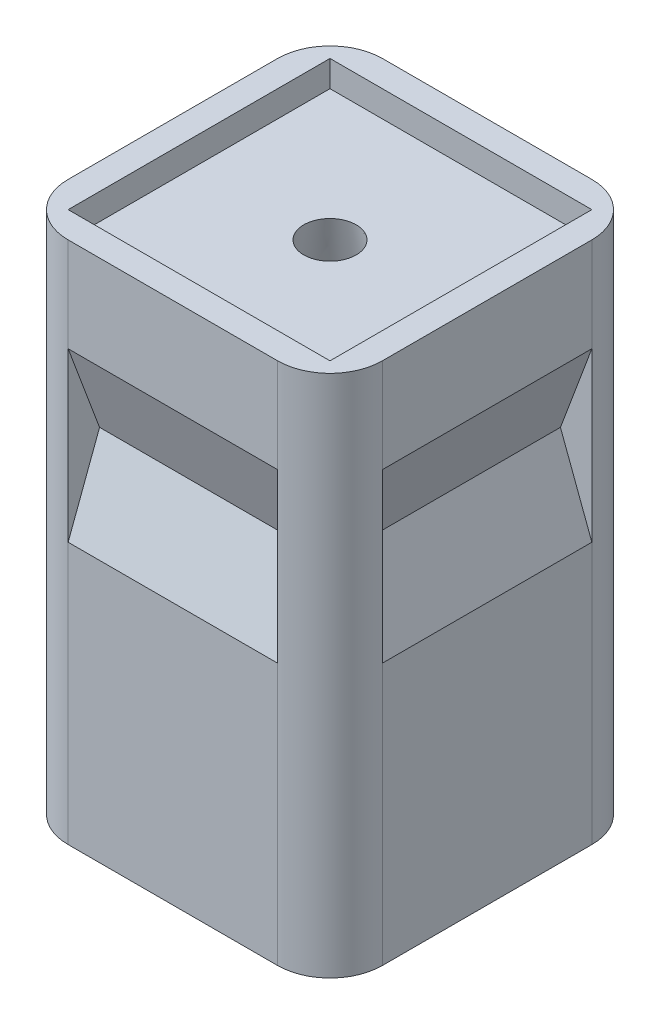
from build123d import *

# Parameters (mm, degrees)
SKETCH2_W           = 30
SKETCH2_H           = 30
BOSS_EXTRUDE1_DEPTH = 50
SKETCH3_W           = 25
SKETCH3_H           = 25
CUT_EXTRUDE1_DEPTH  = 2.5
FILLET1_R           = 5
CIRPATTERN1_COUNT   = 4


with BuildPart() as part:
    # Sketch2 → Boss-Extrude1 (new body)
    with BuildSketch(Plane(origin=(0, 0, 0), x_dir=(1, 0, 0), z_dir=(0, 1, 0))):
        Rectangle(SKETCH2_W, SKETCH2_H)
    extrude(amount=BOSS_EXTRUDE1_DEPTH)

    # Sketch3 → Cut-Extrude1 (cut)
    with BuildSketch(Plane(origin=(0, 50, 0), x_dir=(1, 0, 0), z_dir=(0, 1, 0))):
        Rectangle(SKETCH3_W, SKETCH3_H)
    extrude(amount=-CUT_EXTRUDE1_DEPTH, mode=Mode.SUBTRACT)

    # Fillet1
    fillet1_edges = [part.edges().sort_by_distance(p)[0] for p in [
        (15, 25, 15),
        (-15, 25, 15),
        (-15, 25, -15),
        (15, 25, -15),
    ]]
    fillet(fillet1_edges, radius=FILLET1_R)

    # Cut-Loft2: read off the stored shape, not the designer's step
    # Cut-Loft2: loft between two sections, ruled curve by curve
    cut_loft2_from = [
        Edge.make_bspline([(0, 0, -12.5), (-25, 0, -12.5), (-25, 0, 12.5), (0, 0, 12.5), (25, 0, 12.5), (25, 0, -12.5), (0, 0, -12.5)], [0, 0, 0, 0, 0.5, 0.5, 0.5, 1, 1, 1, 1], 3, [1, 0.333333333, 0.333333333, 1, 0.333333333, 0.333333333, 1]),
    ]
    cut_loft2_to = [
        Edge.make_bspline([(0.784484005, 47.5, -2.373728048), (-3.962972092, 47.5, -3.942696057), (-5.531940101, 47.5, 0.804760039), (-0.784484005, 47.5, 2.373728048), (3.962972092, 47.5, 3.942696057), (5.531940101, 47.5, -0.804760039), (0.784484005, 47.5, -2.373728048)], [0, 0, 0, 0, 0.5, 0.5, 0.5, 1, 1, 1, 1], 3, [1, 0.333333333, 0.333333333, 1, 0.333333333, 0.333333333, 1]),
    ]
    cut_loft2 = Solid(Shell([*[Face.make_surface_from_curves(cut_loft2_from[k], cut_loft2_to[k]) for k in range(1)], Face(Wire(cut_loft2_from)), Face(Wire(cut_loft2_to))]))
    add(cut_loft2, mode=Mode.SUBTRACT)

    # Cut-Sweep1: sweep along a curve in space
    with BuildLine() as cut_sweep1_path:
        Line((-10, 50, 15), (10, 50, 15))
    # Sketch9 → Cut-Sweep1 (sweep, cut)
    with BuildSketch(Plane.ZY):
        Polygon((15, 41), (12, 33), (15, 25), align=None)
    cut_sweep1 = sweep(path=cut_sweep1_path.line, mode=Mode.SUBTRACT)

    # CirPattern1: Cut-Sweep1 ×4 about axis
    cirpattern1_axis = Axis((0, 0, 0), (0, 1, 0))
    for i in range(1, CIRPATTERN1_COUNT):
        add(cut_sweep1.rotate(cirpattern1_axis, i * 360 / CIRPATTERN1_COUNT), mode=Mode.SUBTRACT)


solid = part.part
